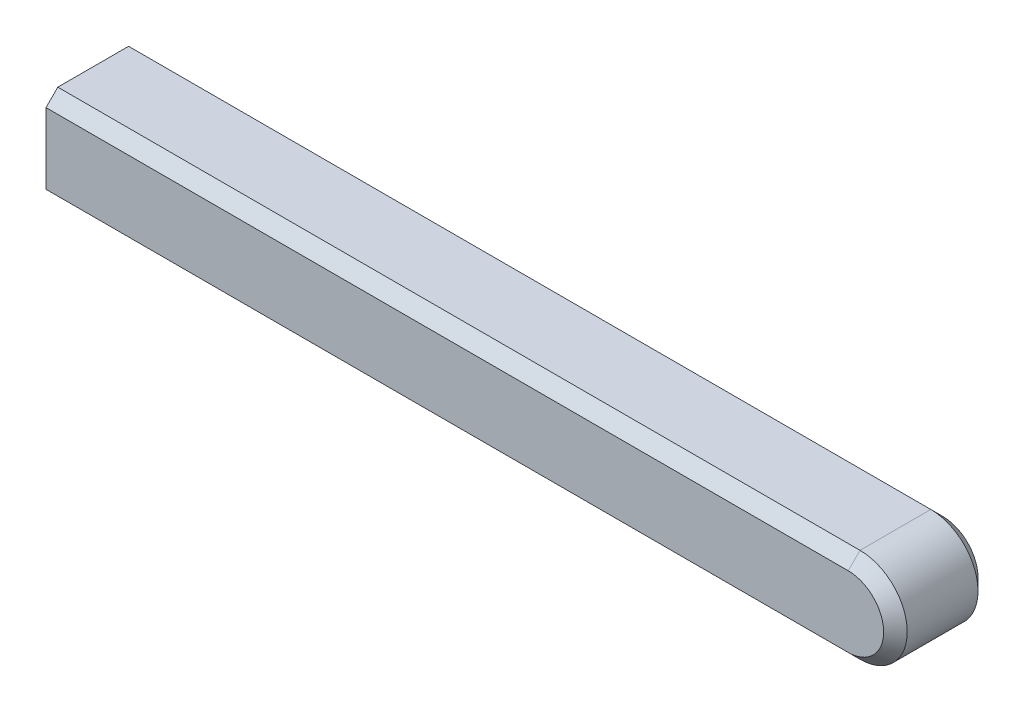
from build123d import *

# Parameters (mm, degrees)
EXTRUDE1_DEPTH = 2
CHAMFER1_SIZE  = 0.25


with BuildPart() as part:
    # body → Extrude1 (new body)
    with BuildSketch(Plane.XY):
        with BuildLine():
            Line((0, 0), (17, 0))
            ThreePointArc((17, 0), (18, 1), (17, 2))
            Line((17, 2), (0, 2))
            Line((0, 2), (0, 0))
        make_face()
    extrude(amount=EXTRUDE1_DEPTH)

    # Chamfer1
    chamfer1_edges = [part.edges().sort_by_distance(p)[0] for p in [
        (8.5, 2, 0),
        (18, 1, 0),
        (8.5, 0, 0),
        (8.5, 2, 2),
        (18, 1, 2),
        (8.5, 0, 2),
    ]]
    chamfer(chamfer1_edges, length=CHAMFER1_SIZE)


solid = part.part
